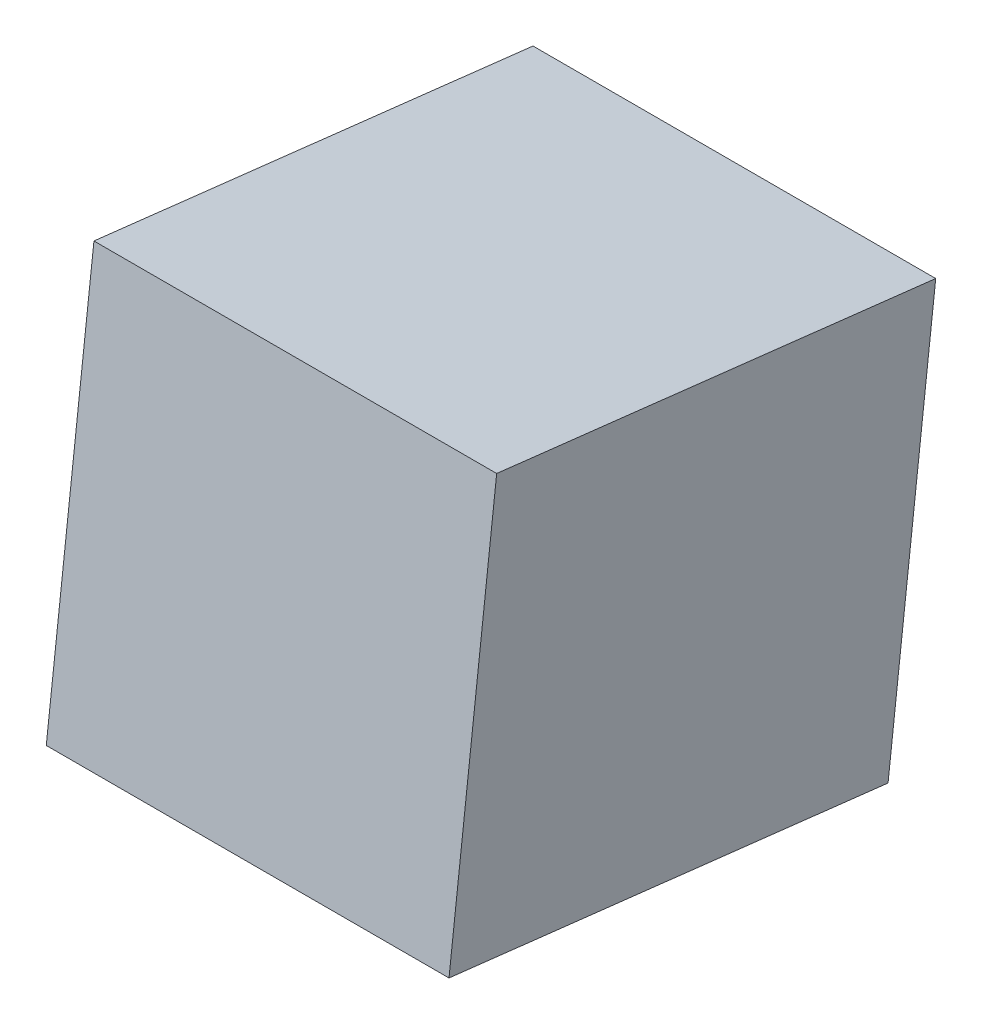
from build123d import *

# Parameters (mm, degrees)
SKETCH1_W           = 154
SKETCH1_H           = 169
BOSS_EXTRUDE1_DEPTH = 159


with BuildPart() as part:
    # Sketch1 → Boss-Extrude1 (new body)
    with BuildSketch(Plane(origin=(0, 358.879876801, -41.422455829), x_dir=(1, 0, 0), z_dir=(-6.837425950214788e-15, 0.9934047622419533, -0.1146602736566085))):
        with Locations((-135, 211.357042425)):
            Rectangle(SKETCH1_W, SKETCH1_H)
    extrude(amount=BOSS_EXTRUDE1_DEPTH)


solid = part.part
